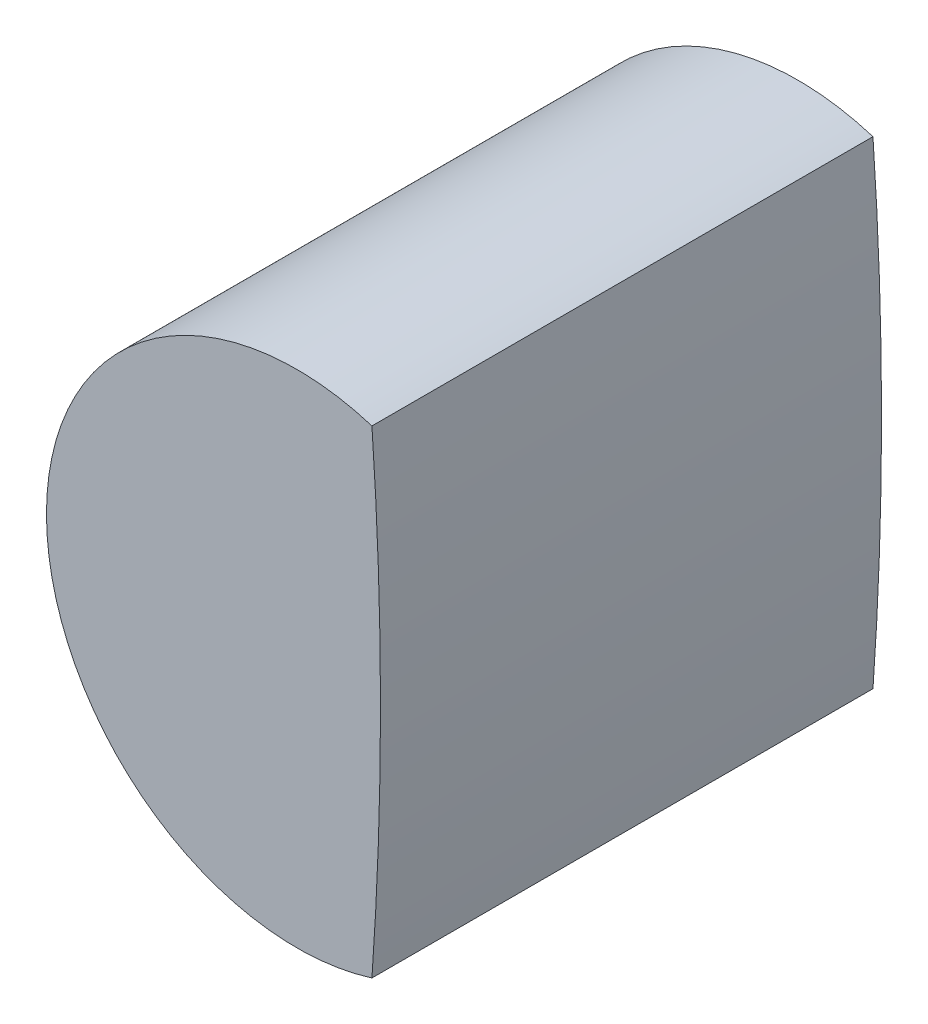
from build123d import *

# Parameters (mm, degrees)
BOSS_EXTRU_1_DEPTH = 3


with BuildPart() as part:
    # Esquisse1 → Boss.-Extru.1 (new body)
    with BuildSketch(Plane.XY):
        with BuildLine():
            ThreePointArc((0.448717949, 1.431311358), (-1.5, 0), (0.448717949, -1.431311358))
            ThreePointArc((0.448717949, -1.431311358), (0.5, 0), (0.448717949, 1.431311358))
        make_face()
    extrude(amount=BOSS_EXTRU_1_DEPTH)


solid = part.part
